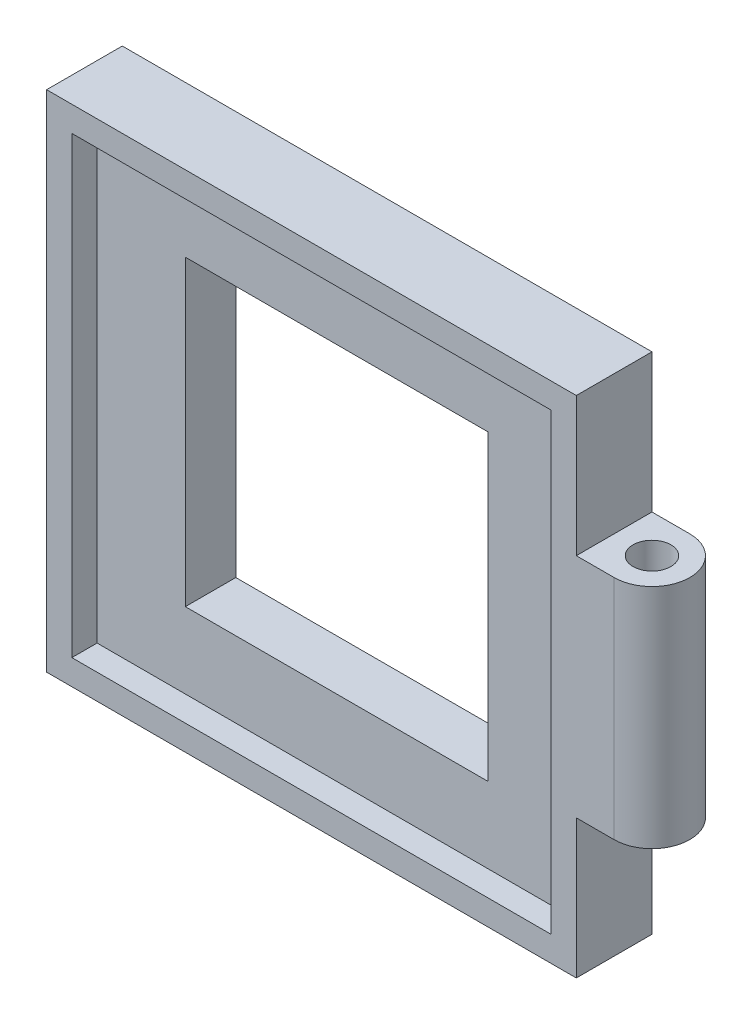
from build123d import *

# Parameters (mm, degrees)
CROQUIS1_W                   = 21
CROQUIS1_H                   = 3
SALIENTE_EXTRUIR1_DEPTH      = 20
SALIENTE_EXTRUIR2_DEPTH      = 4.5
SALIENTE_EXTRUIR2_DEPTH_BACK = 4.5
CROQUIS3_R                   = 0.75
CORTAR_EXTRUIR2_REACH        = 26.316
CROQUIS5_W                   = 19
CROQUIS5_H                   = 18
CROQUIS6_W                   = 19
CROQUIS6_H                   = 18
CROQUIS6_W_2                 = 12
CROQUIS6_H_2                 = 12
SALIENTE_EXTRUIR3_DEPTH      = 2


with BuildPart() as part:
    # Croquis1 → Saliente-Extruir1 (new body)
    with BuildSketch(Plane(origin=(0, 0, 0), x_dir=(1, 0, 0), z_dir=(0, 1, 0))):
        Rectangle(CROQUIS1_W, CROQUIS1_H)
    extrude(amount=SALIENTE_EXTRUIR1_DEPTH)

    # Croquis3 → Saliente-Extruir2 (add, two sides: drawn at the far end of the back side and taken through both)
    with BuildSketch(Plane(origin=(0, 10, 0), x_dir=(1, 0, 0), z_dir=(0, 1, 0)).offset(-SALIENTE_EXTRUIR2_DEPTH_BACK)):
        with BuildLine():
            Line((10.5, 1.5), (10.5, -1.5))
            Line((10.5, -1.5), (12, -1.5))
            ThreePointArc((12, -1.5), (13.5, 0), (12, 1.5))
            Line((12, 1.5), (10.5, 1.5))
        make_face()
        with Locations((12, 0)):
            Circle(CROQUIS3_R, mode=Mode.SUBTRACT)
    extrude(amount=SALIENTE_EXTRUIR2_DEPTH + SALIENTE_EXTRUIR2_DEPTH_BACK)

    # Croquis5 → Cortar-Extruir2 (cut, up to next)
    with BuildSketch(Plane.XY.offset(1.5), mode=Mode.PRIVATE) as cortar_extruir2_sk1:
        with Locations((0, 10)):
            Rectangle(CROQUIS5_W, CROQUIS5_H)
    cortar_extruir2_tool1 = extrude(cortar_extruir2_sk1.sketch, amount=-CORTAR_EXTRUIR2_REACH, mode=Mode.PRIVATE) & part.part
    add(cortar_extruir2_tool1.solids().sort_by_distance((0, 10, 1.5))[0], mode=Mode.SUBTRACT)

    # Croquis6 → Saliente-Extruir3 (add)
    with BuildSketch(Plane(origin=(0, 0, -1.5), x_dir=(-1, 0, 0), z_dir=(0, 0, -1))):
        with Locations((0, 10)):
            Rectangle(CROQUIS6_W, CROQUIS6_H)
        with Locations((0, 10)):
            Rectangle(CROQUIS6_W_2, CROQUIS6_H_2, mode=Mode.SUBTRACT)
    extrude(amount=-SALIENTE_EXTRUIR3_DEPTH)


solid = part.part
